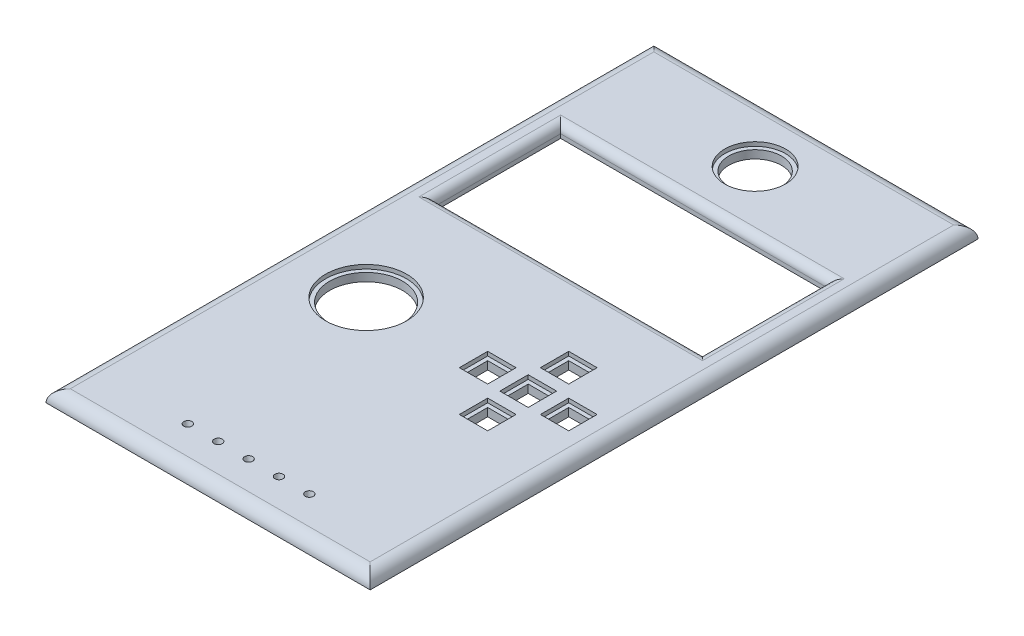
from build123d import *

# Parameters (mm, degrees)
SKETCH1_W           = 80
SKETCH1_H           = 150
BOSS_EXTRUDE1_DEPTH = 3
SKETCH2_W           = 66
SKETCH2_H           = 31
CUT_EXTRUDE1_DEPTH  = 3
SKETCH4_R           = 7.5
CUT_EXTRUDE2_DEPTH  = 1
SKETCH5_R           = 6.5
CUT_EXTRUDE3_DEPTH  = 19
SKETCH6_R           = 10
CUT_EXTRUDE4_DEPTH  = 1
SKETCH8_R           = 9
CUT_EXTRUDE5_DEPTH  = 86.023526156
SKETCH9_W           = 7
SKETCH9_H           = 7
CUT_EXTRUDE6_DEPTH  = 1
SKETCH12_W          = 5
SKETCH12_H          = 5
CUT_EXTRUDE7_DEPTH  = 86.023526156
FILLET1_R           = 3
FILLET2_R           = 2
SKETCH15_W          = 7
SKETCH15_H          = 7
CUT_EXTRUDE9_DEPTH  = 1
SKETCH16_W          = 5
SKETCH16_H          = 5
CUT_EXTRUDE10_DEPTH = 86.023526156


with BuildPart() as part:
    # Sketch1 → Boss-Extrude1 (new body)
    with BuildSketch(Plane(origin=(0, 0, 0), x_dir=(1, 0, 0), z_dir=(0, 1, 0))):
        Rectangle(SKETCH1_W, SKETCH1_H)
    extrude(amount=BOSS_EXTRUDE1_DEPTH)

    # Sketch2 → Cut-Extrude1 (cut)
    with BuildSketch(Plane(origin=(0, 3, 0), x_dir=(1, 0, 0), z_dir=(0, 1, 0))):
        with Locations((0, 29.5)):
            Rectangle(SKETCH2_W, SKETCH2_H)
    extrude(amount=-CUT_EXTRUDE1_DEPTH, mode=Mode.SUBTRACT)

    # Sketch4 → Cut-Extrude2 (cut)
    with BuildSketch(Plane(origin=(0, 3, 0), x_dir=(1, 0, 0), z_dir=(0, 1, 0))):
        with Locations(Location((0, 60, 0), (0, 0, 270))):
            Circle(SKETCH4_R)
    extrude(amount=-CUT_EXTRUDE2_DEPTH, mode=Mode.SUBTRACT)

    # Sketch5 → Cut-Extrude3 (cut)
    with BuildSketch(Plane(origin=(0, 2, 0), x_dir=(1, 0, 0), z_dir=(0, 1, 0))):
        with Locations(Location((0, 60, 0), (0, 0, 270))):
            Circle(SKETCH5_R)
    extrude(amount=-CUT_EXTRUDE3_DEPTH, mode=Mode.SUBTRACT)

    # Sketch6 → Cut-Extrude4 (cut)
    with BuildSketch(Plane(origin=(0, 3, 0), x_dir=(1, 0, 0), z_dir=(0, 1, 0))):
        with Locations(Location((-20, -16, 0), (0, 0, 270))):
            Circle(SKETCH6_R)
    extrude(amount=-CUT_EXTRUDE4_DEPTH, mode=Mode.SUBTRACT)

    # Sketch8 → Cut-Extrude5 (cut, through all)
    with BuildSketch(Plane(origin=(0, 2, 0), x_dir=(1, 0, 0), z_dir=(0, 1, 0))):
        with Locations(Location((-20, -16, 0), (0, 0, 270))):
            Circle(SKETCH8_R)
    extrude(amount=-CUT_EXTRUDE5_DEPTH, mode=Mode.SUBTRACT)

    # Sketch9 → Cut-Extrude6 (cut)
    with BuildSketch(Plane(origin=(0, 3, 0), x_dir=(1, 0, 0), z_dir=(0, 1, 0))):
        with Locations((20, -6)):
            Rectangle(SKETCH9_W, SKETCH9_H)
        with Locations((20, -26)):
            Rectangle(SKETCH9_W, SKETCH9_H)
        with Locations((10, -16)):
            Rectangle(SKETCH9_W, SKETCH9_H)
        with Locations((30, -16)):
            Rectangle(SKETCH9_W, SKETCH9_H)
    extrude(amount=-CUT_EXTRUDE6_DEPTH, mode=Mode.SUBTRACT)

    # Sketch12 → Cut-Extrude7 (cut, through all)
    with BuildSketch(Plane(origin=(0, 2, 0), x_dir=(1, 0, 0), z_dir=(0, 1, 0))):
        with Locations((20, -6)):
            Rectangle(SKETCH12_W, SKETCH12_H)
        with Locations((10, -16)):
            Rectangle(SKETCH12_W, SKETCH12_H)
        with Locations((30, -16)):
            Rectangle(SKETCH12_W, SKETCH12_H)
        with Locations((20, -26)):
            Rectangle(SKETCH12_W, SKETCH12_H)
    extrude(amount=-CUT_EXTRUDE7_DEPTH, mode=Mode.SUBTRACT)

    # Cut-Extrude8 cone 1 section (through the dimple's axis) → Cut-Extrude8 (revolve, cut)
    with BuildSketch(Plane(origin=(0, 3, 65), x_dir=(0, 0, 1), z_dir=(1, 0, 0))):
        Polygon((0, 0), (1, 0), (0, 3.732050808), align=None)
    revolve(axis=Axis((0, 3, 65), (0, -1, 0)), mode=Mode.SUBTRACT)

    # Cut-Extrude8 cone 2 section (through the dimple's axis) → Cut-Extrude8 cone 2 (revolve, cut)
    with BuildSketch(Plane(origin=(-7.5, 3, 65), x_dir=(0, 0, 1), z_dir=(1, 0, 0))):
        Polygon((0, 0), (1, 0), (0, 3.732050808), align=None)
    revolve(axis=Axis((-7.5, 3, 65), (0, -1, 0)), mode=Mode.SUBTRACT)

    # Cut-Extrude8 cone 3 section (through the dimple's axis) → Cut-Extrude8 cone 3 (revolve, cut)
    with BuildSketch(Plane(origin=(-15, 3, 65), x_dir=(0, 0, 1), z_dir=(1, 0, 0))):
        Polygon((0, 0), (1, 0), (0, 3.732050808), align=None)
    revolve(axis=Axis((-15, 3, 65), (0, -1, 0)), mode=Mode.SUBTRACT)

    # Cut-Extrude8 cone 4 section (through the dimple's axis) → Cut-Extrude8 cone 4 (revolve, cut)
    with BuildSketch(Plane(origin=(7.5, 3, 65), x_dir=(0, 0, 1), z_dir=(1, 0, 0))):
        Polygon((0, 0), (1, 0), (0, 3.732050808), align=None)
    revolve(axis=Axis((7.5, 3, 65), (0, -1, 0)), mode=Mode.SUBTRACT)

    # Cut-Extrude8 cone 5 section (through the dimple's axis) → Cut-Extrude8 cone 5 (revolve, cut)
    with BuildSketch(Plane(origin=(15, 3, 65), x_dir=(0, 0, 1), z_dir=(1, 0, 0))):
        Polygon((0, 0), (1, 0), (0, 3.732050808), align=None)
    revolve(axis=Axis((15, 3, 65), (0, -1, 0)), mode=Mode.SUBTRACT)

    # Fillet1
    fillet1_edges = [part.edges().sort_by_distance(p)[0] for p in [
        (40, 3, 0),
        (0, 3, -75),
        (-40, 3, 0),
        (0, 3, 75),
    ]]
    fillet(fillet1_edges, radius=FILLET1_R - 0.0001)  # a hair under: the kernel refuses the full size

    # Fillet2
    fillet2_edges = [part.edges().sort_by_distance(p)[0] for p in [
        (33, 3, -29.5),
        (0, 3, -45),
        (-33, 3, -29.5),
        (0, 3, -14),
    ]]
    fillet(fillet2_edges, radius=FILLET2_R)

    # Sketch15 → Cut-Extrude9 (cut)
    with BuildSketch(Plane(origin=(0, 3, 0), x_dir=(1, 0, 0), z_dir=(0, 1, 0))):
        with Locations((20, -16)):
            Rectangle(SKETCH15_W, SKETCH15_H)
    extrude(amount=-CUT_EXTRUDE9_DEPTH, mode=Mode.SUBTRACT)

    # Sketch16 → Cut-Extrude10 (cut, through all)
    with BuildSketch(Plane(origin=(0, 2, 0), x_dir=(1, 0, 0), z_dir=(0, 1, 0))):
        with Locations((20, -16)):
            Rectangle(SKETCH16_W, SKETCH16_H)
    extrude(amount=-CUT_EXTRUDE10_DEPTH, mode=Mode.SUBTRACT)


solid = part.part
